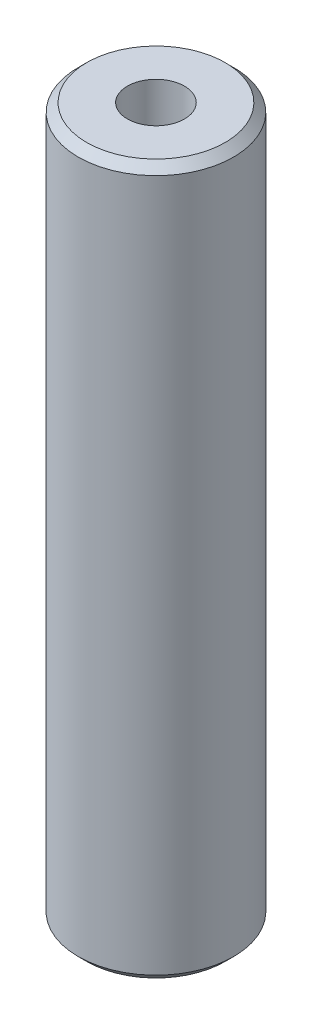
from build123d import *

# Parameters (mm, degrees)
SKETCH1_R           = 52.5
BOSS_EXTRUDE1_DEPTH = 479.358730515
SKETCH2_R           = 19.274571489
CUT_EXTRUDE1_DEPTH  = 486.074522647
CHAMFER1_SIZE       = 5.694217748


with BuildPart() as part:
    # Sketch1 → Boss-Extrude1 (new body)
    with BuildSketch(Plane(origin=(0, 0, 0), x_dir=(1, 0, 0), z_dir=(0, 1, 0))):
        Circle(SKETCH1_R)
    extrude(amount=BOSS_EXTRUDE1_DEPTH)

    # Sketch2 → Cut-Extrude1 (cut, through all)
    with BuildSketch(Plane(origin=(0, 0, 0), x_dir=(1, 0, 0), z_dir=(0, 1, 0))):
        Circle(SKETCH2_R)
    extrude(amount=CUT_EXTRUDE1_DEPTH, mode=Mode.SUBTRACT)

    # Chamfer1
    chamfer1_edges = [part.edges().sort_by_distance(p)[0] for p in [
        (-52.5, 479.358730515, 0),
        (-52.5, 0, 0),
    ]]
    chamfer(chamfer1_edges, length=CHAMFER1_SIZE)


solid = part.part
